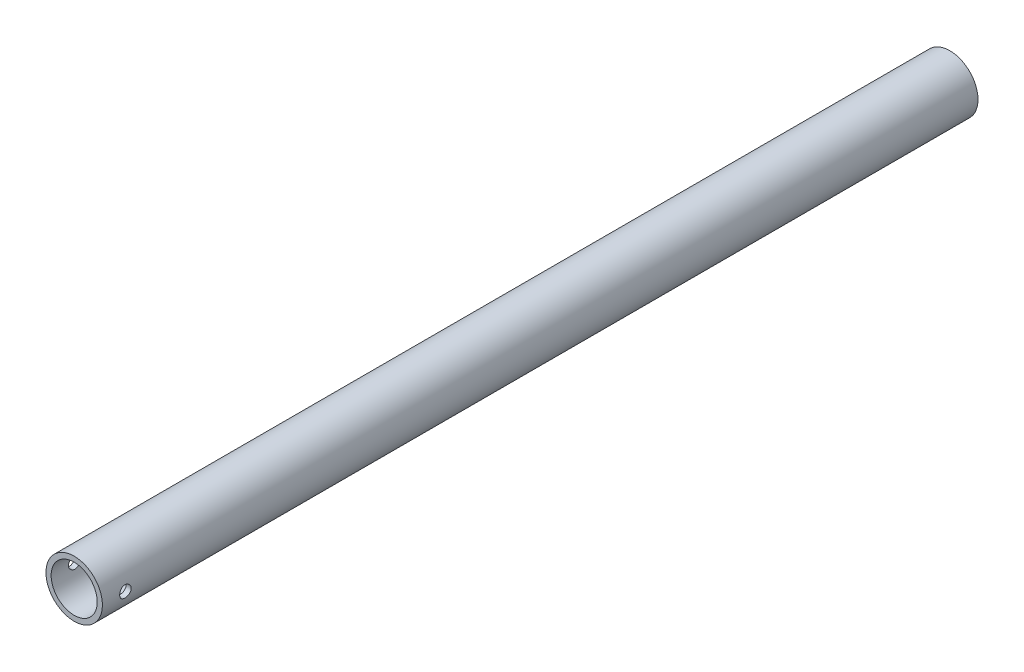
from build123d import *

# Parameters (mm, degrees)
SKETCH1_R               = 12.25
BOSS_EXTRUDE1_DEPTH     = 380
CUT_EXTRUDE1_DEPTH      = 381.394696335
CUT_EXTRUDE1_DEPTH_BACK = 381.394696335
SKETCH2_R               = 2.5
CUT_EXTRUDE2_DEPTH      = 381.394696442
CUT_EXTRUDE2_DEPTH_BACK = 381.394696442
SKETCH3_R               = 10
CUT_EXTRUDE3_START      = -12.2500001
CUT_EXTRUDE3_OUTLINE_R  = 4
CUT_EXTRUDE3_DEPTH      = 3.08483721


# Read off the part's stored shape, not the designer's step: Cut-Extrude3
with BuildPart() as part:
    # Sketch1 → Boss-Extrude1 (new body)
    with BuildSketch(Plane.XY):
        Circle(SKETCH1_R)
    extrude(amount=BOSS_EXTRUDE1_DEPTH)

    # Sketch2 → Cut-Extrude1 (cut, two sides: drawn at the far end of the back side and taken through both)
    with BuildSketch(Plane(origin=(0, 0, 0), x_dir=(0, 0, -1), z_dir=(1, 0, 0)).offset(-CUT_EXTRUDE1_DEPTH_BACK)):
        with Locations((-370, 0)):
            Circle(SKETCH2_R)
    extrude(amount=CUT_EXTRUDE1_DEPTH + CUT_EXTRUDE1_DEPTH_BACK, mode=Mode.SUBTRACT)

    # Sketch3 → Cut-Extrude2 (cut, two sides: drawn at the far end of the back side and taken through both)
    with BuildSketch(Plane.XY.offset(380).offset(-CUT_EXTRUDE2_DEPTH_BACK)):
        Circle(SKETCH3_R)
    extrude(amount=CUT_EXTRUDE2_DEPTH + CUT_EXTRUDE2_DEPTH_BACK, mode=Mode.SUBTRACT)

    # Cut-Extrude3 outline → Cut-Extrude3 (cut)
    with BuildSketch(Plane(origin=(0, 0, 0), x_dir=(1, 0, 0), z_dir=(0, 1, 0)).offset(CUT_EXTRUDE3_START)):
        with Locations((0, -20)):
            Circle(CUT_EXTRUDE3_OUTLINE_R)
    extrude(amount=CUT_EXTRUDE3_DEPTH, mode=Mode.SUBTRACT)


solid = part.part
